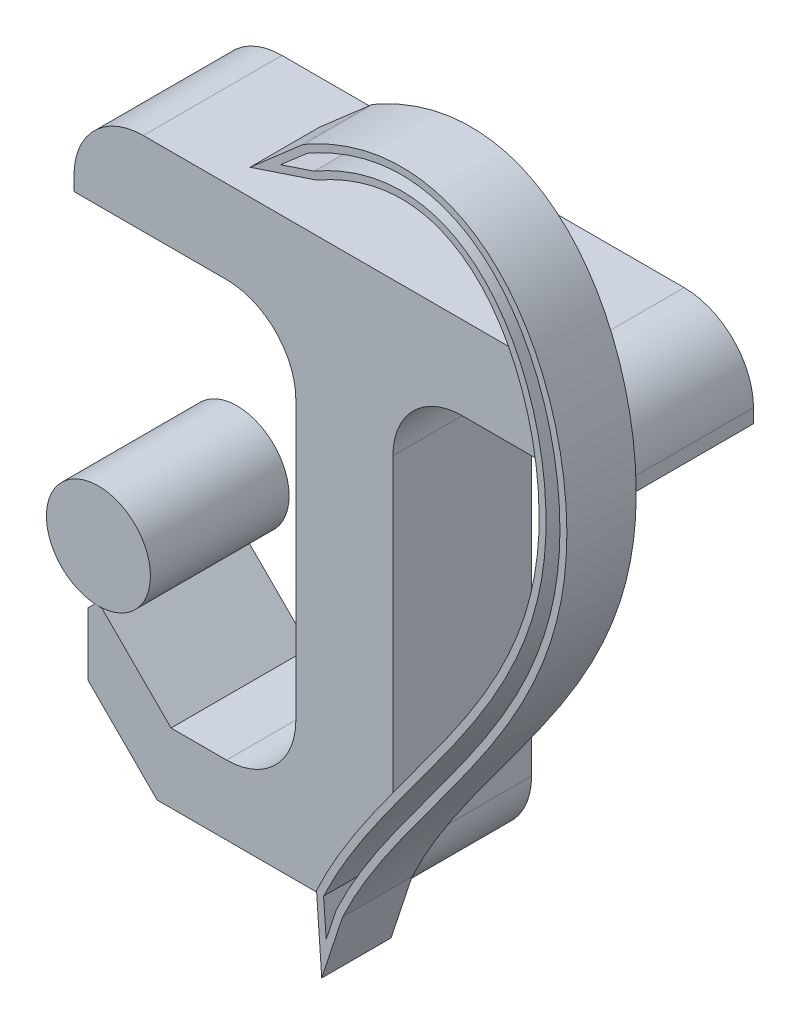
from build123d import *

# Parameters (mm, degrees)
BOSS_EXTRUDE1_DEPTH = 20
EXTRUDE_THIN1_DEPTH = 10
SKETCH5_R           = 7.5
BOSS_EXTRUDE2_DEPTH = 20


# Read off the part's stored shape, not the designer's step: Extrude-Thin1
with BuildPart() as part:
    # Sketch1 → Boss-Extrude1 (new body)
    with BuildSketch(Plane.XY):
        with BuildLine():
            Line((-10, 0), (-18, 0))
            Line((-18, 0), (-28, 10))
            Line((-28, 10), (-29, 10))
            Line((-29, 10), (-30, 9))
            Line((-30, 9), (-30, 0))
            Line((-30, 0), (-20, -10))
            Line((-20, -10), (4, -10))
            ThreePointArc((4, -10), (11.071067812, -7.071067812), (14, 0))
            Line((14, 0), (14, 50))
            ThreePointArc((14, 50), (16.928932188, 57.071067812), (24, 60))
            Line((24, 60), (46, 60))
            Line((46, 60), (46, 62))
            ThreePointArc((46, 62), (43.071067812, 69.071067812), (36, 72))
            Line((36, 72), (-22, 72))
            ThreePointArc((-22, 72), (-29.071067812, 69.071067812), (-32, 62))
            Line((-32, 62), (-32, 60))
            Line((-32, 60), (-10, 60))
            ThreePointArc((-10, 60), (-2.928932188, 57.071067812), (0, 50))
            Line((0, 50), (0, 10))
            ThreePointArc((0, 10), (-2.928932188, 2.928932188), (-10, 0))
        make_face()
    extrude(amount=BOSS_EXTRUDE1_DEPTH)

    # Extrude-Thin1 outline → Extrude-Thin1 (add)
    with BuildSketch(Plane.XY.offset(20)):
        with BuildLine():
            Line((13.73148986, -10.359047867), (16.741396884, -1.220059446))
            add(Edge.make_bspline(
                [(16.741396884, -1.220059446), (17.938240855, 1.323469225), (19.307708402, 3.752480804), (22.244361382, 8.479339506), (23.812565414, 10.776510898), (27.035275719, 15.313601471), (28.690184228, 17.553253811), (31.991080828, 22.038476224), (33.637986515, 24.284980825), (38.424574069, 31.115486386), (41.408492734, 35.783389329), (44.395072339, 42.028190425), (44.95507469, 43.297728181), (45.729279361, 45.238321303), (45.976373543, 45.891237597), (46.446784447, 47.210182884), (46.670294458, 47.877042866), (47.714694496, 51.215852174), (48.322116947, 53.923225355), (48.86716598, 58.042586022), (48.988213777, 59.425362719), (49.076217631, 61.514428935), (49.090024461, 62.213257221), (49.087251753, 63.615752982), (49.070578711, 64.319153164), (48.976651737, 66.416036203), (48.855819179, 67.803201228), (48.501882233, 70.556785471), (48.268780425, 71.923205167), (47.684831673, 74.634287385), (47.33404649, 75.978961319), (46.709542441, 77.977803302), (46.484948091, 78.641048673), (45.999973816, 79.960926888), (45.740217846, 80.615526301), (44.911555517, 82.547489325), (44.291569032, 83.798878974), (43.243756398, 85.612139279), (42.874801633, 86.205897607), (42.093252638, 87.369776955), (41.679134889, 87.941763226), (40.373322387, 89.60370733), (39.425854628, 90.63180605), (37.870510106, 92.034688127), (37.329640806, 92.479038062), (36.19853105, 93.316481218), (35.606549323, 93.709991891), (33.796764696, 94.778267797), (32.531779498, 95.352000631), (30.543567471, 95.997721333), (29.865605841, 96.176907114), (28.478128706, 96.460552184), (27.780741346, 96.562520522), (25.688004954, 96.755498301), (24.287696072, 96.734383445), (22.180361797, 96.502947526), (21.483658094, 96.393044193), (20.110834488, 96.116901703), (19.432903121, 95.950477369), (17.421648072, 95.375848366), (16.110835589, 94.892380819), (14.181053464, 94.045359098), (13.5434948, 93.742447874), (12.288407262, 93.103712794), (11.670283671, 92.766283002), (11.058524625, 92.416649831)],
                knots=[0, 0, 0, 0, 0.0625, 0.0625, 0.125, 0.125, 0.1875, 0.1875, 0.25, 0.25, 0.375, 0.375, 0.40625, 0.40625, 0.421875, 0.421875, 0.4375, 0.4375, 0.5, 0.5, 0.53125, 0.53125, 0.546875, 0.546875, 0.5625, 0.5625, 0.59375, 0.59375, 0.625, 0.625, 0.65625, 0.65625, 0.671875, 0.671875, 0.6875, 0.6875, 0.71875, 0.71875, 0.734375, 0.734375, 0.75, 0.75, 0.78125, 0.78125, 0.796875, 0.796875, 0.8125, 0.8125, 0.84375, 0.84375, 0.859375, 0.859375, 0.875, 0.875, 0.90625, 0.90625, 0.921875, 0.921875, 0.9375, 0.9375, 0.96875, 0.96875, 0.984375, 0.984375, 1, 1, 1, 1], degree=3))
            Line((11.058524625, 92.416649831), (3.395470658, 85.73345921))
            Line((3.395470658, 85.73345921), (13.043322477, 88.943815616))
            add(Edge.make_bspline(
                [(12.984095469, 0.189080392), (13.261797049, 0.780847724), (13.544202903, 1.369495068), (14.128982979, 2.533546248), (14.429461172, 3.110207578), (15.352675472, 4.825746728), (15.997153895, 5.950204518), (17.999265958, 9.278029772), (19.425218913, 11.43608621), (23.847809312, 17.814266063), (26.988743693, 21.938688252), (31.535112958, 28.23477496), (33.023516937, 30.351412365), (35.156773016, 33.592259728), (35.851619954, 34.684226984), (37.19320582, 36.890024529), (37.840373262, 38.004462966), (39.694006852, 41.390696998), (40.812899945, 43.705266889), (42.243521786, 47.298117326), (42.679721979, 48.518139619), (43.453486056, 50.995602181), (43.787141344, 52.240262022), (44.621079781, 55.992845574), (44.952865574, 58.519537042), (45.104277149, 62.348142544), (45.098718071, 63.630585128), (44.979130066, 66.207552003), (44.864011143, 67.506916098), (44.528589217, 70.066963523), (44.308419924, 71.33305785), (43.760072877, 73.836566763), (43.431958037, 75.073998054), (42.656090183, 77.517092827), (42.208542731, 78.722810893), (41.429612055, 80.502814187), (41.150917716, 81.093254), (40.55782601, 82.253058494), (40.244009978, 82.82160586), (39.245864754, 84.489970459), (38.505733349, 85.553098585), (37.251565625, 87.05313228), (36.809002202, 87.536961226), (35.886378091, 88.450034762), (35.4044844, 88.881624917), (34.395261664, 89.689733894), (33.867946067, 90.066269015), (33.038643006, 90.584613031), (32.754651161, 90.750229859), (32.179971757, 91.061223792), (31.889309524, 91.206707046), (30.41940811, 91.884122288), (29.190503028, 92.26636718), (27.587336181, 92.542136319), (27.262184559, 92.587277805), (26.611184933, 92.656602561), (26.285998299, 92.680809615), (25.311324544, 92.723847227), (24.662721974, 92.713147507), (23.367636487, 92.620984522), (22.720198773, 92.539335562), (21.431235483, 92.312436181), (20.797445687, 92.168725542), (18.923138973, 91.660998622), (17.709439107, 91.221082518), (15.929389806, 90.44658053), (15.342863868, 90.16909984), (14.181924608, 89.579856337), (13.609225337, 89.267241012), (13.043322477, 88.943815616)],
                knots=[0, 0, 0, 0, 0.015625, 0.015625, 0.03125, 0.03125, 0.0625, 0.0625, 0.125, 0.125, 0.25, 0.25, 0.3125, 0.3125, 0.34375, 0.34375, 0.375, 0.375, 0.4375, 0.4375, 0.46875, 0.46875, 0.5, 0.5, 0.5625, 0.5625, 0.59375, 0.59375, 0.625, 0.625, 0.65625, 0.65625, 0.6875, 0.6875, 0.71875, 0.71875, 0.734375, 0.734375, 0.75, 0.75, 0.78125, 0.78125, 0.796875, 0.796875, 0.8125, 0.8125, 0.828125, 0.828125, 0.8359375, 0.8359375, 0.84375, 0.84375, 0.875, 0.875, 0.8828125, 0.8828125, 0.890625, 0.890625, 0.90625, 0.90625, 0.921875, 0.921875, 0.9375, 0.9375, 0.96875, 0.96875, 0.984375, 0.984375, 1, 1, 1, 1], degree=3))
            Line((12.984095469, 0.189080392), (13.73148986, -10.359047867))
        make_face()
        with BuildLine():
            add(Edge.make_bspline(
                [(15.810552446, -0.849646892), (16.325029135, 0.246675635), (17.416570039, 2.396390397), (19.868642716, 6.664133605), (23.334211223, 11.909222729), (27.886053322, 18.166968374), (32.565450825, 24.478770316), (37.106117738, 30.949094987), (41.236694479, 37.687027442), (44.676980175, 44.808635171), (47.135313488, 52.414034167), (48.301398377, 60.618911739), (47.90588021, 69.361888608), (45.977615911, 77.918895481), (42.476746042, 85.645696397), (38.155102392, 90.8189096), (33.781763935, 93.766830125), (30.054070359, 95.243697473), (25.926399271, 95.859309256), (22.209918519, 95.579579954), (19.091851854, 94.852492514), (16.683612614, 94.050216163), (14.614999506, 93.159672681), (12.931642394, 92.315516301), (12.064904025, 91.84001985), (11.640953043, 91.59772294)],
                knots=[0, 0, 0, 0, 0.03125, 0.0625, 0.125, 0.1875, 0.25, 0.3125, 0.375, 0.4375, 0.5, 0.5625, 0.625, 0.6875, 0.75, 0.8125, 0.84375, 0.875, 0.90625, 0.9375, 0.953125, 0.96875, 0.984375, 0.9921875, 1, 1, 1, 1], degree=3))
            Line((15.810552446, -0.849646892), (14.37010001, -5.22329632))
            Line((14.37010001, -5.22329632), (14, 0))
            add(Edge.make_bspline(
                [(14, 0), (23.413026625, 20.058660289), (61.290224665, 48.838836775), (35.977417085, 103.202930404), (12.633351969, 89.861305832)],
                knots=[0, 0, 0, 0, 0.556335669, 1, 1, 1, 1], degree=3))
            Line((12.633351969, 89.861305832), (7.80942606, 88.25612763))
            Line((7.80942606, 88.25612763), (11.640953043, 91.59772294))
        make_face(mode=Mode.SUBTRACT)
    extrude(amount=EXTRUDE_THIN1_DEPTH)


with BuildPart() as body_2:
    # Sketch5 → Boss-Extrude2 (new, through all)
    with BuildSketch(Plane.XY.offset(20)):
        with Locations((-28.47326066, 17.5)):
            Circle(SKETCH5_R)
    extrude(amount=-BOSS_EXTRUDE2_DEPTH)


solid = Compound([part.part, body_2.part])
